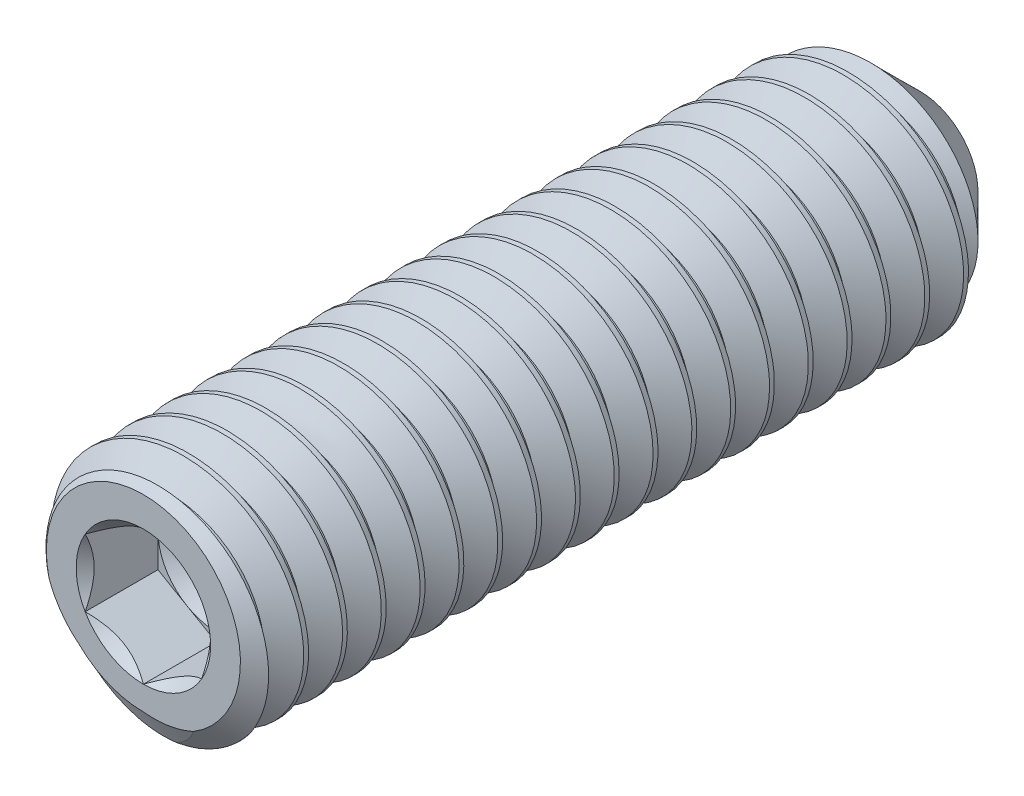
from build123d import *

# Parameters (mm, degrees)
CUT_EXTRUDE1_DEPTH = 0.9375
CUT_SWEEP1_PITCH   = 0.5


with BuildPart() as part:
    # Sketch11 → Revolve1 (revolve)
    with BuildSketch(Plane(origin=(0, 0, 0), x_dir=(0, 0, -1), z_dir=(1, 0, 0)), mode=Mode.PRIVATE) as revolve1_sk:
        Polygon((-5, 0), (-5, 1.25), (-4.824948115, 1.5), (4.25, 1.5), (5, 0.75), (4.549354536, 0), align=None)
    revolve(revolve1_sk.sketch.rotate(Axis((0, 0, -4.549354536), (0, 0, -1)), 180), axis=Axis((0, 0, -4.549354536), (0, 0, -1)))

    # Sketch2 → Cut-Extrude1 (cut)
    with BuildSketch(Plane.XY.offset(5)):
        Polygon((0, 0.866025404), (-0.75, 0.433012702), (-0.75, -0.433012702), (0, -0.866025404), (0.75, -0.433012702), (0.75, 0.433012702), align=None)
    extrude(amount=-CUT_EXTRUDE1_DEPTH, mode=Mode.SUBTRACT)

    # Cut-Extrude2 cone 1 section (through the dimple's axis) → Cut-Extrude2 (revolve, cut)
    with BuildSketch(Plane(origin=(0, 0, 5), x_dir=(0, -1, 0), z_dir=(1, 0, 0))):
        Polygon((0, 0), (0.866025404, 0), (0, 0.866025404), align=None)
    revolve(axis=Axis((0, 0, 5), (0, 0, -1)), mode=Mode.SUBTRACT)

    # Cut-Extrude3 cone 1 section (through the dimple's axis) → Cut-Extrude3 (revolve, cut)
    with BuildSketch(Plane(origin=(0, 0, 4.0625), x_dir=(0, -1, 0), z_dir=(1, 0, 0))):
        Polygon((0, 0), (0.75, 0), (0, 0.433012702), align=None)
    revolve(axis=Axis((0, 0, 4.0625), (0, 0, -1)), mode=Mode.SUBTRACT)

    # Cut-Sweep1: the profile of Sketch6 screwed along a right-hand helix of 22 turns, 6 arcs to a turn; built about Z, then put on its axis
    cut_sweep1_z = Axis((0, 0, 0), (0, 0, 1))
    cut_sweep1_corners = [(1.175240474, 0, -0.1875), (1.527063294, 0, 0.015625), (1.527063294, 0, -0.453125), (1.175240474, 0, -0.25)]
    with BuildLine(mode=Mode.PRIVATE) as cut_sweep1_profile:
        Line(cut_sweep1_corners[0], cut_sweep1_corners[1])
        Line(cut_sweep1_corners[1], cut_sweep1_corners[2])
        Line(cut_sweep1_corners[2], cut_sweep1_corners[3])
        Line(cut_sweep1_corners[3], cut_sweep1_corners[0])
    cut_sweep1_cap = Face(cut_sweep1_profile.wire())
    cut_sweep1_turn_angles = [0, 30, 60, 90, 120, 150, 180, 210, 240, 270, 300, 330, 360]
    cut_sweep1_turn_weights = [1, 0.8660254037844387, 1, 0.8660254037844387, 1, 0.8660254037844387, 1, 0.8660254037844387, 1, 0.8660254037844387, 1, 0.8660254037844387, 1]
    cut_sweep1_turn_rails = [Edge.make_bspline([Vector(p[0], p[1], 0).rotate(cut_sweep1_z, cut_sweep1_turn_angles[k]) / cut_sweep1_turn_weights[k] + Vector(0, 0, p[2] + CUT_SWEEP1_PITCH * cut_sweep1_turn_angles[k] / 360) for k in range(13)], [0, 0, 0, 1, 1, 2, 2, 3, 3, 4, 4, 5, 5, 6, 6, 6], 2, cut_sweep1_turn_weights) for p in cut_sweep1_corners]
    cut_sweep1_turn_sides = [Face.make_surface_from_curves(cut_sweep1_turn_rails[p[0]], cut_sweep1_turn_rails[p[1]]) for p in [(0, 1), (1, 2), (2, 3), (3, 0)]]
    cut_sweep1 = Plane(origin=(0, 0, -5), x_dir=(0, 1, 0), z_dir=(0, 0, 1)) * Solid(Shell([*[p.moved(Location((0, 0, CUT_SWEEP1_PITCH * i))) for i in range(22) for p in cut_sweep1_turn_sides], cut_sweep1_cap, cut_sweep1_cap.rotate(cut_sweep1_z, 7920).moved(Location((0, 0, CUT_SWEEP1_PITCH * 7920 / 360)))]))
    add(cut_sweep1, mode=Mode.SUBTRACT)


solid = part.part
